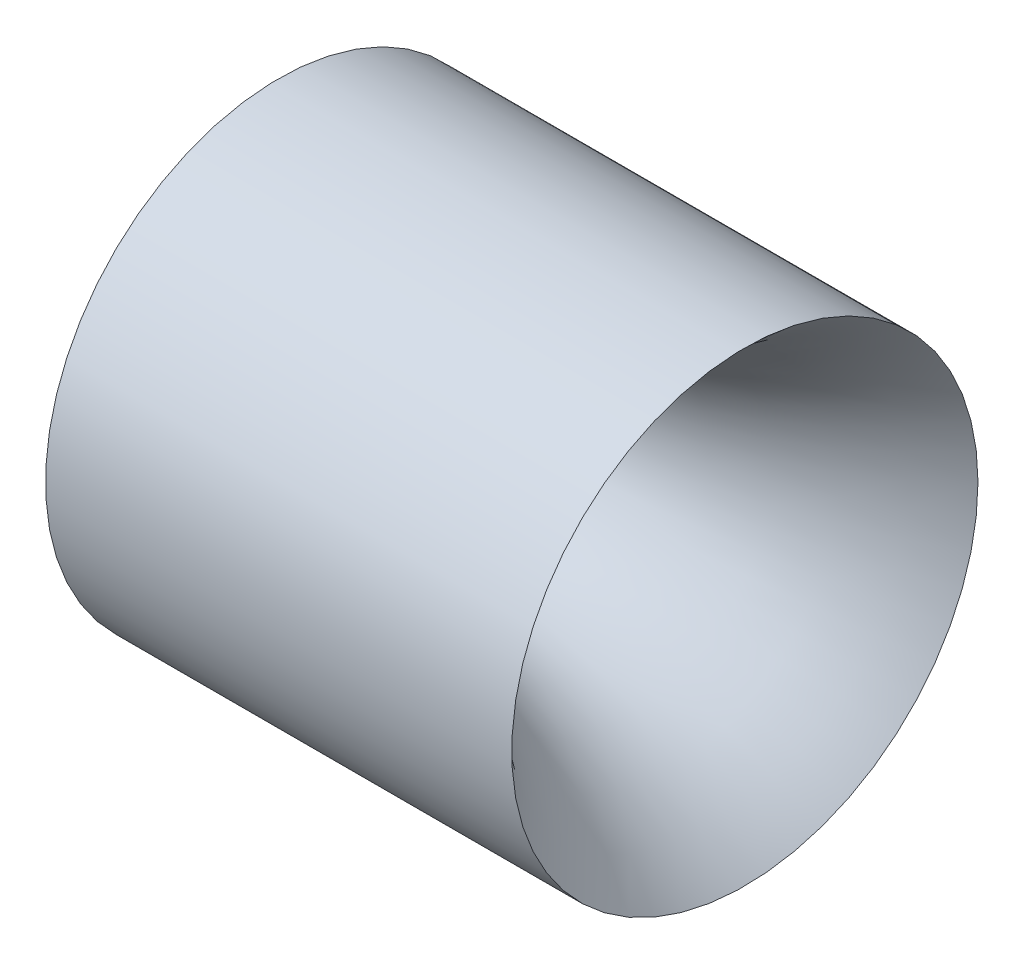
from build123d import *

# Parameters (mm, degrees)
ESQUISSE3_R        = 5
ESQUISSE3_R_2      = 2.2
BOSS_EXTRU_2_DEPTH = 10
CONG_1_R           = 10


with BuildPart() as part:
    # Esquisse3 → Boss.-Extru.2 (new body)
    with BuildSketch(Plane(origin=(0, 0, 0), x_dir=(0, 0, -1), z_dir=(1, 0, 0))):
        Circle(ESQUISSE3_R)
        Circle(ESQUISSE3_R_2, mode=Mode.SUBTRACT)
    extrude(amount=BOSS_EXTRU_2_DEPTH)

    # Congé1
    # the kernel refuses this fillet: 10 mm, written as the material it takes off along each edge
    with BuildSketch(Plane(origin=(10, 0, 0), x_dir=(0, 0, -1), z_dir=(0, -1, 0))) as cong_1_piece_1:
        with BuildLine():
            CenterArc((12.2, -6.939740629), CONG_1_R, 136.054480438, 43.945519562)
            Line((5, 0), (4.856, 0.138794813))
            ThreePointArc((4.856, 0.138794813), (3.6, 0.2), (2.2, 0.2))
            Line((2.2, 0.2), (2, 0))
            Line((2, 0), (2, -6.939740629))
            Line((2, -6.939740629), (2.2, -6.939740629))
        make_face()
    revolve(axis=Axis((10, 0, 0), (1, 0, 0)), mode=Mode.SUBTRACT)


solid = part.part
